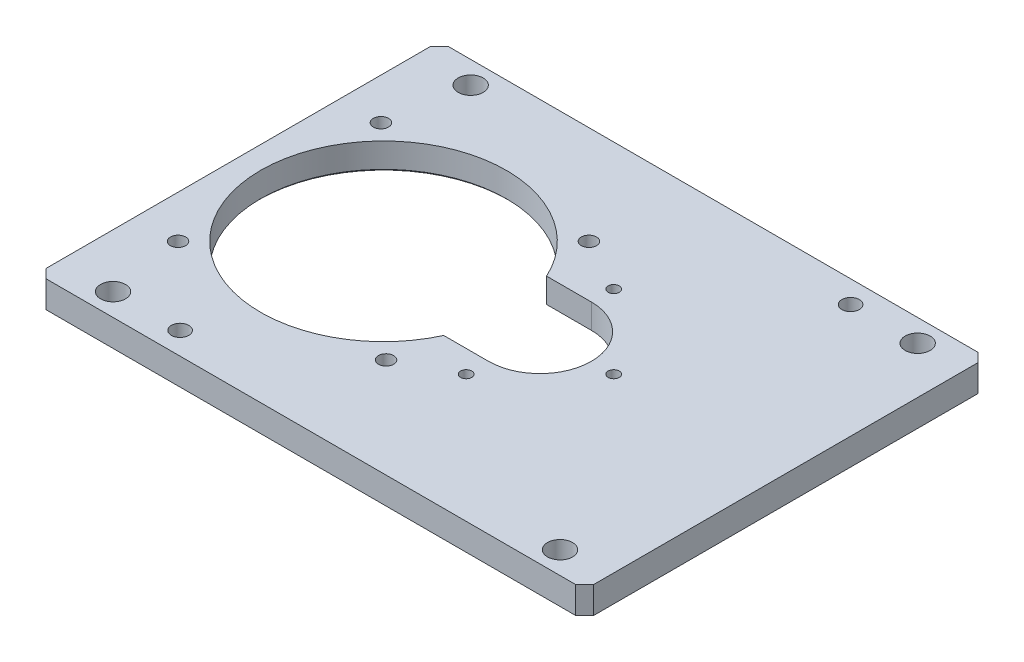
from build123d import *

# Parameters (mm, degrees)
SKETCH1_W                 = 245
SKETCH1_H                 = 180
BOSS_EXTRUDE1_DEPTH       = 12
CHAMFER2_SIZE             = 4
M8_TAPPED_HOLE1_D         = 6.8
M6_TAPPED_HOLE1_D         = 5
CHAMFER3_SIZE             = 1
SKETCH_PATTERN1_OUTLINE_R = 2.5
SKETCH_PATTERN1_DEPTH     = 12
SKETCH_PATTERN2_OUTLINE_R = 3.4
SKETCH_PATTERN2_DEPTH     = 12
CUT_EXTRUDE1_REACH        = 164.693
SKETCH11_R                = 5.6
SKETCH_PATTERN4_OUTLINE_R = 3.9
SKETCH_PATTERN4_DEPTH     = 12


# Read off the part's stored shape, not the designer's step: Sketch-Pattern1, Sketch-Pattern2, Sketch-Pattern4
with BuildPart() as part:
    # Sketch1 → Boss-Extrude1 (new body)
    with BuildSketch(Plane(origin=(0, 0, 0), x_dir=(1, 0, 0), z_dir=(0, 1, 0))):
        with Locations((-12.5, 0)):
            Rectangle(SKETCH1_W, SKETCH1_H)
        with BuildLine():
            Line((0, 23), (-20.040016013, 23))
            ThreePointArc((-20.040016013, 23), (-125, 0), (-20.040016013, -23))
            Line((-20.040016013, -23), (0, -23))
            ThreePointArc((0, -23), (23, 0), (0, 23))
        make_face(mode=Mode.SUBTRACT)
    extrude(amount=BOSS_EXTRUDE1_DEPTH)

    # Chamfer2
    chamfer2_edges = [part.edges().sort_by_distance(p)[0] for p in [
        (-135, 6, -90),
        (110, 6, -90),
        (110, 6, 90),
        (-135, 6, 90),
    ]]
    chamfer(chamfer2_edges, length=CHAMFER2_SIZE)

    # M8 Tapped Hole1 (through all)
    with Locations(Plane(origin=(0, 12, 0), x_dir=(1, 0, 0), z_dir=(0, 1, 0))):
        with Locations((-115.961940777, -45.961940777)):
            Hole(M8_TAPPED_HOLE1_D / 2)

    # M6 Tapped Hole1 (through all)
    with Locations(Plane(origin=(0, 12, 0), x_dir=(1, 0, 0), z_dir=(0, 1, 0))):
        with Locations((0, 33)):
            Hole(M6_TAPPED_HOLE1_D / 2)

    # Chamfer3
    chamfer3_edges = [part.edges().sort_by_distance(p)[0] for p in [
        (23, 0, 0),
        (-10.020008006, 0, -23),
        (-125, 0, 0),
        (-10.020008006, 0, 23),
    ]]
    chamfer(chamfer3_edges, length=CHAMFER3_SIZE)

    # Sketch-Pattern1 outline → Sketch-Pattern1 (cut)
    with BuildSketch(Plane(origin=(0, 0, 0), x_dir=(1, 0, 0), z_dir=(0, 1, 0))):
        with Locations((0, -33)):
            Circle(SKETCH_PATTERN1_OUTLINE_R)
        with Locations((33, 0)):
            Circle(SKETCH_PATTERN1_OUTLINE_R)
    extrude(amount=SKETCH_PATTERN1_DEPTH, mode=Mode.SUBTRACT)

    # Sketch-Pattern2 outline → Sketch-Pattern2 (cut)
    with BuildSketch(Plane(origin=(0, 0, 0), x_dir=(1, 0, 0), z_dir=(0, 1, 0))):
        with Locations((-116.529552601, 45.387230966)):
            Circle(SKETCH_PATTERN2_OUTLINE_R)
        with Locations((-24.038059223, 45.961940777)):
            Circle(SKETCH_PATTERN2_OUTLINE_R)
        with Locations((-23.470447399, -45.387230966)):
            Circle(SKETCH_PATTERN2_OUTLINE_R)
    extrude(amount=SKETCH_PATTERN2_DEPTH, mode=Mode.SUBTRACT)

    # Sketch11 → Cut-Extrude1 (cut, up to next)
    with BuildSketch(Plane(origin=(0, 12, 0), x_dir=(1, 0, 0), z_dir=(0, 1, 0)), mode=Mode.PRIVATE) as cut_extrude1_sk1:
        with Locations(Location((-111, -80, 0), (0, 0, 270))):
            Circle(SKETCH11_R)
    cut_extrude1_tool1 = extrude(cut_extrude1_sk1.sketch, amount=-CUT_EXTRUDE1_REACH, mode=Mode.PRIVATE) & part.part
    cut_extrude1 = cut_extrude1_tool1.solids().sort_by_distance((-111, 12, 80))[0]
    add(cut_extrude1, mode=Mode.SUBTRACT)

    # Sketch-Pattern3: Cut-Extrude1 at 3 more places
    with Locations((200, 0, 0), (200, 0, -160), (0, 0, -160)):
        add(cut_extrude1, mode=Mode.SUBTRACT)

    # Sketch-Pattern4 outline → Sketch-Pattern4 (cut)
    with BuildSketch(Plane(origin=(0, 0, 0), x_dir=(1, 0, 0), z_dir=(0, 1, 0))):
        with Locations((-81, -80)):
            Circle(SKETCH_PATTERN4_OUTLINE_R)
        with Locations((59, 80)):
            Circle(SKETCH_PATTERN4_OUTLINE_R)
    extrude(amount=SKETCH_PATTERN4_DEPTH, mode=Mode.SUBTRACT)


solid = part.part
